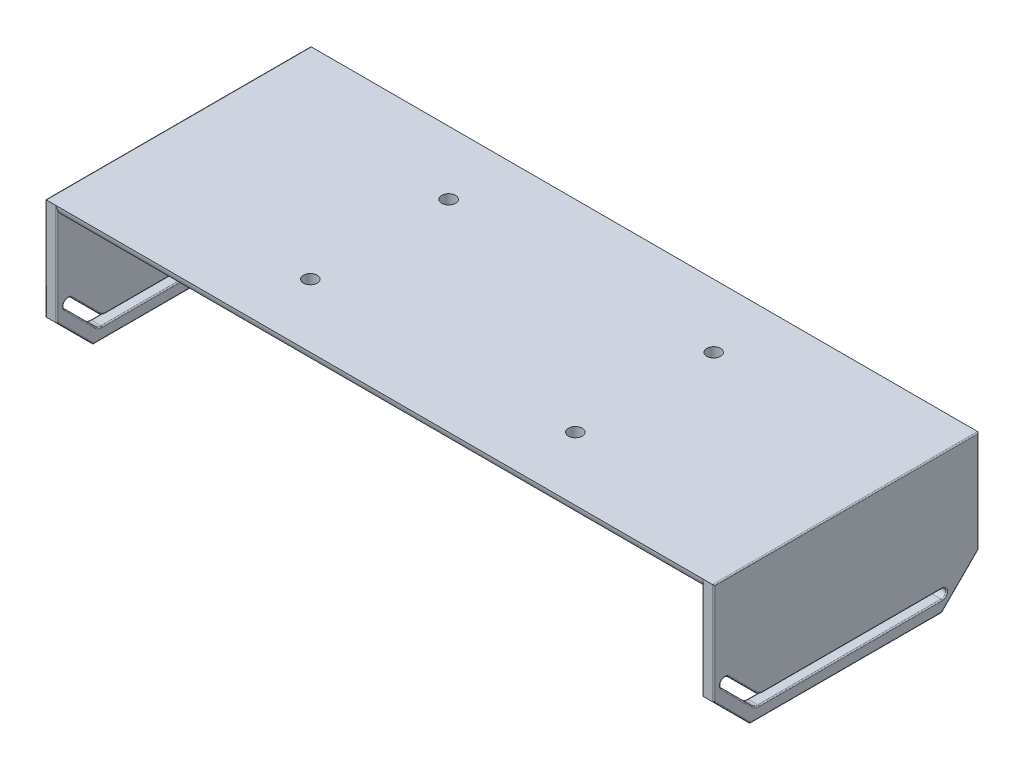
from build123d import *

# Parameters (mm, degrees)
SZKIC1_W                    = 580
SZKIC1_H                    = 230
DODANIE_WYCI_GNI_CIE1_DEPTH = 120
SZKIC2_W                    = 560
SZKIC2_H                    = 110
WYTNIJ_WYCI_GNI_CIE1_DEPTH  = 390.101529167
WYTNIJ_WYCI_GNI_CIE2_DEPTH  = 604.344843352
WYTNIJ_WYCI_GNI_CIE3_DEPTH  = 604.344843352
OTWORY_USTALAJ_CE_12_0MM1_D = 12
ZAOKR_GLENIE1_R             = 10
ZAOKR_GLENIE2_R             = 1


with BuildPart() as part:
    # Szkic1 → Dodanie-wyciągnięcie1 (new body)
    with BuildSketch(Plane(origin=(0, 0, 0), x_dir=(1, 0, 0), z_dir=(0, 1, 0))):
        Rectangle(SZKIC1_W, SZKIC1_H)
    extrude(amount=DODANIE_WYCI_GNI_CIE1_DEPTH)

    # Szkic2 → Wytnij-wyciągnięcie1 (cut, through all)
    with BuildSketch(Plane.XY.offset(115)):
        with Locations((0, 55)):
            Rectangle(SZKIC2_W, SZKIC2_H)
    extrude(amount=-WYTNIJ_WYCI_GNI_CIE1_DEPTH, mode=Mode.SUBTRACT)

    # Szkic3 → Wytnij-wyciągnięcie2 (cut, through all)
    with BuildSketch(Plane.ZY.offset(290)):
        Polygon((115, 31.819805153), (83.180194847, 0), (115, 0), align=None)
        Polygon((-115, 31.819805153), (-83.180194847, 0), (-115, 0), align=None)
    extrude(amount=-WYTNIJ_WYCI_GNI_CIE2_DEPTH, mode=Mode.SUBTRACT)

    # Szkic4 → Wytnij-wyciągnięcie3 (cut, through all)
    with BuildSketch(Plane.ZY.offset(290)):
        with BuildLine():
            Line((81.381204973, 12.343145751), (107.928932188, 38.890872965))
            ThreePointArc((107.928932188, 38.890872965), (107.928932188, 44.547727215), (102.272077939, 44.547727215))
            Line((102.272077939, 44.547727215), (78.067496474, 20.343145751))
            ThreePointArc((78.067496474, 20.343145751), (75.472109684, 18.60896374), (72.410642225, 18))
            Line((72.410642225, 18), (-83.180194847, 18))
            ThreePointArc((-83.180194847, 18), (-87.180194847, 14), (-83.180194847, 10))
            Line((-83.180194847, 10), (75.724350724, 10))
            ThreePointArc((75.724350724, 10), (78.785818183, 10.60896374), (81.381204973, 12.343145751))
        make_face()
    extrude(amount=-WYTNIJ_WYCI_GNI_CIE3_DEPTH, mode=Mode.SUBTRACT)

    # Otwory ustalające Ø12.0mm1 (through all)
    with Locations(Plane(origin=(0, 120, 0), x_dir=(1, 0, 0), z_dir=(0, 1, 0))):
        with Locations((-115, 60), (115, 60), (115, -60), (-115, -60)):
            Hole(OTWORY_USTALAJ_CE_12_0MM1_D / 2)

    # Zaokrąglenie1
    zaokr_glenie1_edges = [part.edges().sort_by_distance(p)[0] for p in [
        (0, 110, -115),
        (0, 110, 115),
    ]]
    fillet(zaokr_glenie1_edges, radius=ZAOKR_GLENIE1_R - 0.0001)  # a hair under: the kernel refuses the full size

    # Zaokrąglenie2
    zaokr_glenie2_edges = [part.edges().sort_by_distance(p)[0] for p in [
        (-290, 120, 0),
        (-280, 75.909852577, 115),
        (280, 75.909852577, 115),
        (280, 75.909852577, -115),
        (280, 0, 0),
        (280, 15.909902577, -99.090097423),
        (280, 15.909902577, 99.090097423),
        (-280, 0, 0),
        (290, 0, 0),
        (-290, 0, 0),
        (-280, 15.909902577, 99.090097423),
        (290, 15.909902577, 99.090097423),
        (-290, 15.909902577, 99.090097423),
        (290, 120, 0),
        (-280, 15.909902577, -99.090097423),
        (290, 15.909902577, -99.090097423),
        (-290, 15.909902577, -99.090097423),
        (280, 10, -3.727922061),
        (280, 10.60896374, 78.785818183),
        (280, 25.617009358, 94.655068581),
        (280, 44.547727215, 107.928932188),
        (280, 32.445436483, 90.169787207),
        (280, 18.60896374, 75.472109684),
        (280, 18, -5.384776311),
        (280, 14, -87.180194847),
        (290, 75.909902577, 115),
        (-290, 75.909902577, 115),
        (-290, 75.909902577, -115),
        (290, 75.909902577, -115),
        (-280, 14, -87.180194847),
        (290, 14, -87.180194847),
        (-280, 18, -5.384776311),
        (290, 18, -5.384776311),
        (-280, 18.60896374, 75.472109684),
        (290, 18.60896374, 75.472109684),
        (-280, 32.445436483, 90.169787207),
        (290, 32.445436483, 90.169787207),
        (-280, 44.547727215, 107.928932188),
        (290, 44.547727215, 107.928932188),
        (-280, 25.617009358, 94.655068581),
        (290, 25.617009358, 94.655068581),
        (-280, 10.60896374, 78.785818183),
        (290, 10.60896374, 78.785818183),
        (-280, 10, -3.727922061),
        (290, 10, -3.727922061),
        (-290, 14, -87.180194847),
        (-290, 10, -3.727922061),
        (-290, 10.60896374, 78.785818183),
        (-290, 25.617009358, 94.655068581),
        (-290, 44.547727215, 107.928932188),
        (-290, 32.445436483, 90.169787207),
        (-290, 18.60896374, 75.472109684),
        (-290, 18, -5.384776311),
    ]]
    fillet(zaokr_glenie2_edges, radius=ZAOKR_GLENIE2_R)


solid = part.part
